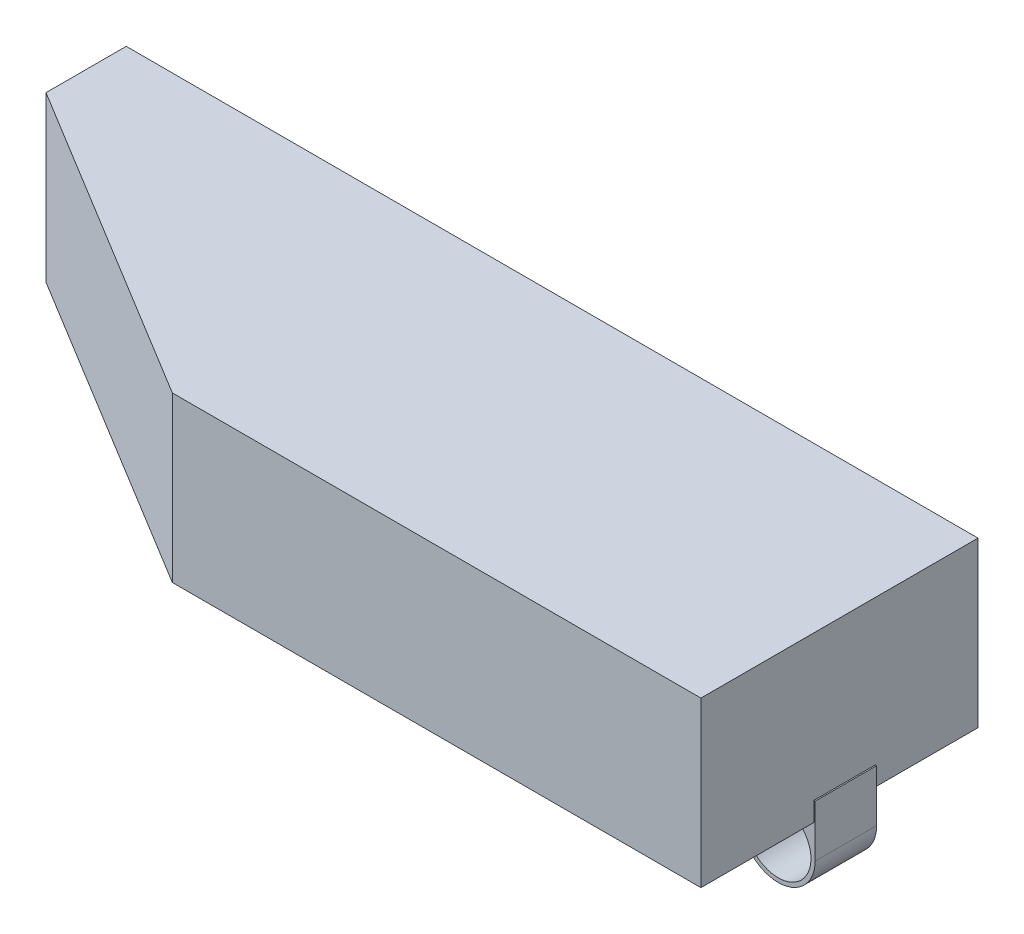
from build123d import *

# Parameters (mm, degrees)
Y_KSEKLIK_EKSTR_ZYON1_DEPTH = 80
Y_KSEKLIK_EKSTR_ZYON6_START = -50
IZIM4_R                     = 16
Y_KSEKLIK_EKSTR_ZYON6_DEPTH = 30


with BuildPart() as part:
    # Çizim3 → Yükseklik-Ekstrüzyon1 (new body)
    with BuildSketch(Plane(origin=(0, 0, 0), x_dir=(1, 0, 0), z_dir=(0, 1, 0))):
        Polygon((-257.534328512, 0.000206653), (-415, 95.915871832), (-415, 135), (0, 135), (0, 0), align=None)
    extrude(amount=Y_KSEKLIK_EKSTR_ZYON1_DEPTH)

    # Çizim4 → Yükseklik-Ekstrüzyon6 (add)
    # profile 1 of 2: a face of its own
    with BuildSketch(Plane(origin=(0, 0, -135), x_dir=(-1, 0, 0), z_dir=(0, 0, -1)).offset(Y_KSEKLIK_EKSTR_ZYON6_START)):
        with BuildLine():
            Line((199.380767456, 11.253885018), (199.380767456, -16))
            ThreePointArc((199.380767456, -16), (217.380767456, -34), (235.380767456, -16))
            Line((235.380767456, -16), (235.380767456, 11.253885018))
            Line((235.380767456, 11.253885018), (199.380767456, 11.253885018))
        make_face()
        with Locations((217.380767456, -16)):
            Circle(IZIM4_R, mode=Mode.SUBTRACT)
    # profile 2 of 2: a face of its own
    with BuildSketch(Plane(origin=(0, 0, -135), x_dir=(-1, 0, 0), z_dir=(0, 0, -1)).offset(Y_KSEKLIK_EKSTR_ZYON6_START)):
        with BuildLine():
            Line((-0.619232544, 9.307663541), (-0.619232544, -16))
            ThreePointArc((-0.619232544, -16), (17.380767456, -34), (35.380767456, -16))
            Line((35.380767456, -16), (35.380767456, 9.307663541))
            Line((35.380767456, 9.307663541), (-0.619232544, 9.307663541))
        make_face()
        with Locations((17.380767456, -16)):
            Circle(IZIM4_R, mode=Mode.SUBTRACT)
    extrude(amount=-Y_KSEKLIK_EKSTR_ZYON6_DEPTH)


solid = part.part
